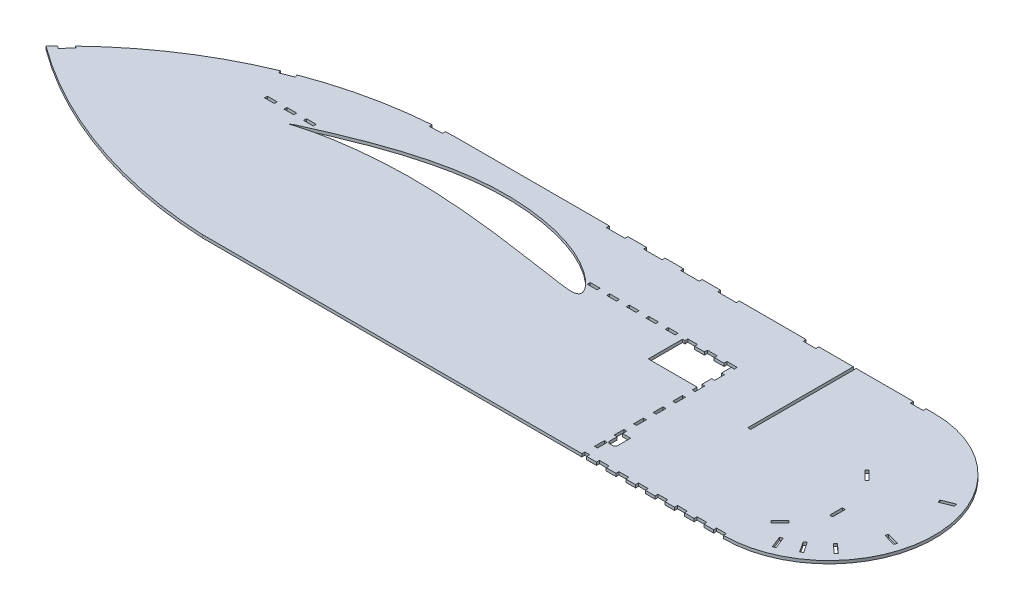
from build123d import *

# Parameters (mm, degrees)
BOSS_EXTRUDE1_DEPTH = 3
SKETCH2_W           = 3
SKETCH2_H           = 13
SKETCH2_W_2         = 13
SKETCH2_H_2         = 3
SKETCH2_W_3         = 19
SKETCH2_W_4         = 10
SKETCH2_H_3         = 10
SKETCH2_W_5         = 4.93
SKETCH2_H_4         = 108
CUT_EXTRUDE1_DEPTH  = 934.342916617


with BuildPart() as part:
    # Sketch1 → Boss-Extrude1 (new body)
    with BuildSketch(Plane(origin=(0, 0, 0), x_dir=(1, 0, 0), z_dir=(0, 1, 0))):
        with BuildLine():
            Line((266.408252791, 0), (800, 0))
            ThreePointArc((800, 0), (908, 108), (800, 216))
            Line((800, 216), (316.294556964, 216))
            ThreePointArc((316.294556964, 216), (154.432198565, 182.326352039), (19.429068043, 86.893169221))
            ThreePointArc((19.429068043, 86.893169221), (136.475600537, 25.133273094), (266.408252791, 0))
        make_face()
    extrude(amount=BOSS_EXTRUDE1_DEPTH)

    # Sketch2 → Cut-Extrude1 (cut, through all)
    with BuildSketch(Plane.XZ):
        Polygon((647.57, -153), (637.57, -153), (637.57, -156), (627.57, -156), (627.57, -153), (617.57, -153), (617.57, -156), (607.57, -156), (607.57, -153), (605.07, -153), (605.07, -118), (655.07, -118), (655.07, -113), (658.07, -113), (658.07, -123), (655.07, -123), (655.07, -133), (658.07, -133), (658.07, -143), (655.07, -143), (655.07, -153), (658.07, -153), (658.07, -156), (647.57, -156), align=None)
        Polygon((823.689305433, -121.232773417), (814.496917278, -130.425161573), (816.618237622, -132.546481916), (825.810625777, -123.354093761), align=None)
        Polygon((833.160643349, -28.105884629), (837.93522035, -16.014424235), (835.144883336, -14.912598773), (830.370306335, -27.004059168), align=None)
        with Locations((837.95655194, -78.816857664)):
            Rectangle(SKETCH2_W, SKETCH2_H)
        with BuildLine():
            Line((658.07, -25.473381029), (658.07, -33))
            Line((658.07, -33), (655.07, -33))
            Line((655.07, -33), (655.07, -43))
            Line((655.07, -43), (658.07, -43))
            Line((658.07, -43), (658.07, -38.673381029))
            Line((658.07, -38.673381029), (666.27, -38.673381029))
            Line((666.27, -38.673381029), (666.27, -25.473381029))
            ThreePointArc((666.27, -25.473381029), (665.537766953, -23.705614076), (663.77, -22.973381029))
            Line((663.77, -22.973381029), (660.57, -22.973381029))
            ThreePointArc((660.57, -22.973381029), (658.802233047, -23.705614076), (658.07, -25.473381029))
        make_face()
        with BuildLine():
            Line((212.57, -142.261782597), (212.57, -142.294782597))
            add(Edge.make_bspline(
                [(212.57, -142.294782597), (212.815137814, -142.460102486), (213.721483955, -143.071338431), (215.664179604, -144.220627165), (218.723437449, -145.777902142), (222.783765044, -147.580430449), (227.75908382, -149.780753256), (233.673151887, -152.372942719), (243.334631626, -156.473964415), (254.071597155, -160.928560196), (265.811315632, -165.551386352), (275.559769605, -169.192616013), (285.820264156, -172.789650289), (300.213165162, -177.442893994), (315.047470761, -181.61442891), (330.216772764, -185.078244178), (341.716798025, -187.262793988), (353.238408154, -188.970546018), (364.74982071, -190.189827969), (376.222154657, -190.889317525), (387.611451467, -191.086885836), (398.853751386, -190.764655348), (413.421420996, -189.696341642), (427.580802498, -187.700042396), (441.195366572, -184.827458978), (450.821943115, -182.319735681), (459.948918056, -179.469695278), (468.511745548, -176.287644359), (476.453624938, -172.824739179), (483.715148146, -169.128859345), (490.24814377, -165.284833696), (496.019667562, -161.40694583), (500.998027396, -157.585747413), (505.147593549, -153.884087589), (508.447339472, -150.382728864), (510.852240131, -147.180842115), (512.23052565, -144.518995071), (512.672376723, -142.438033672), (512.365957104, -140.693980261), (510.836297954, -139.267947677), (508.300825673, -138.604557497), (504.990749494, -138.396901122), (500.845143819, -138.632879923), (495.886387834, -139.207005807), (490.127383335, -140.033765729), (483.600688534, -141.01415409), (476.345974836, -142.081971784), (468.41886468, -143.270863791), (459.86962452, -144.552957933), (447.40415706, -146.414008038), (434.302787697, -148.29198326), (413.230560269, -151.080307043), (394.916461571, -153.170522792), (372.413070638, -155.185169178), (353.278576878, -156.497400442), (334.10390548, -157.12050793), (318.83753012, -157.119300437), (307.569298967, -156.863067348), (296.54483902, -156.342386113), (285.853643217, -155.59861473), (275.586288909, -154.654588864), (265.829573747, -153.556930461), (256.673464041, -152.312824912), (248.205041684, -150.95854436), (240.510067524, -149.523302558), (233.666056009, -148.064077742), (227.735558734, -146.629571507), (222.771530443, -145.20558608), (218.774640723, -143.912633605), (215.724793866, -142.995242016), (213.753356987, -142.496728121), (212.816237246, -142.310670921), (212.57, -142.261782597)],
                knots=[0, 0, 0, 0, 0.001413477, 0.005226038, 0.010781091, 0.017815608, 0.026460951, 0.036790889, 0.048685593, 0.076639155, 0.092362872, 0.109003461, 0.126386903, 0.144339126, 0.181312719, 0.200023431, 0.218712626, 0.237261299, 0.255692478, 0.274037197, 0.292192583, 0.310132767, 0.327788163, 0.362001934, 0.378421226, 0.394286639, 0.40954344, 0.424114253, 0.43793778, 0.450941833, 0.463044023, 0.474154417, 0.484164575, 0.493023962, 0.500713088, 0.507125739, 0.512129705, 0.514904185, 0.517171427, 0.520261618, 0.5242453, 0.529497961, 0.536092185, 0.54406114, 0.553363127, 0.563904543, 0.575614949, 0.588420092, 0.60222661, 0.616944448, 0.648675826, 0.665501113, 0.718564132, 0.736789145, 0.773513212, 0.810244924, 0.828488569, 0.846493195, 0.864125178, 0.88124851, 0.897725282, 0.913415058, 0.928184346, 0.941897285, 0.954411455, 0.965602702, 0.975349728, 0.983575522, 0.990284579, 0.99543259, 0.998799869, 1, 1, 1, 1], degree=3))
        make_face()
        Polygon((879.488683308, -142.121066281), (891.521725575, -147.041014838), (892.657098319, -144.26415893), (880.624056052, -139.344210373), align=None)
        Polygon((883.5475205, -85.58327061), (896.043113277, -81.997163924), (895.215550195, -79.113565591), (882.719957419, -82.699672277), align=None)
        Polygon((865.360730479, -51.33720048), (875.034295558, -42.652608454), (873.030158937, -40.420247282), (863.356593858, -49.104839308), align=None)
        Polygon((849.064781802, -36.758543495), (856.251694152, -25.925801881), (853.751830703, -24.267283646), (846.564918353, -35.10002526), align=None)
        Polygon((822.408918344, -44.734564455), (813.216530188, -35.542176299), (811.095209845, -37.663496643), (820.287598, -46.855884798), align=None)
        with Locations((785, -214.5)):
            Rectangle(SKETCH2_W_2, SKETCH2_H_2)
        with Locations((675.107627624, -214.5)):
            Rectangle(SKETCH2_W_2, SKETCH2_H_2)
        with Locations((590.701810534, -214.5)):
            Rectangle(SKETCH2_W_3, SKETCH2_H_2)
        with Locations((552.701810534, -214.5)):
            Rectangle(SKETCH2_W_3, SKETCH2_H_2)
        with Locations((514.701810534, -214.5)):
            Rectangle(SKETCH2_W_3, SKETCH2_H_2)
        with Locations((476.701810534, -214.5)):
            Rectangle(SKETCH2_W_3, SKETCH2_H_2)
        Polygon((286.653605669, -215.067910052), (299.639993398, -215.662665262), (299.777244601, -212.665806556), (286.790856872, -212.071051345), align=None)
        Polygon((161.18014545, -185.235777135), (173.264783001, -190.027596754), (174.370587528, -187.238834242), (162.285949977, -182.447014623), align=None)
        Polygon((25.225136805, -93.110530953), (34.089712558, -102.619437132), (36.284075522, -100.573765804), (27.419499769, -91.064859625), align=None)
        with Locations((532.57, -154.5)):
            Rectangle(SKETCH2_W_4, SKETCH2_H_2)
        with Locations((552.57, -154.5)):
            Rectangle(SKETCH2_W_4, SKETCH2_H_2)
        with Locations((572.57, -154.5)):
            Rectangle(SKETCH2_W_4, SKETCH2_H_2)
        with Locations((592.57, -154.5)):
            Rectangle(SKETCH2_W_4, SKETCH2_H_2)
        with Locations((656.57, -98)):
            Rectangle(SKETCH2_W, SKETCH2_H_3)
        with Locations((656.57, -78)):
            Rectangle(SKETCH2_W, SKETCH2_H_3)
        with Locations((656.57, -58)):
            Rectangle(SKETCH2_W, SKETCH2_H_3)
        with Locations((656.57, -18)):
            Rectangle(SKETCH2_W, SKETCH2_H_3)
        with Locations((657.535, -1.5)):
            Rectangle(SKETCH2_W_5, SKETCH2_H_2)
        with Locations((675, -1.5)):
            Rectangle(SKETCH2_W_4, SKETCH2_H_2)
        with Locations((695, -1.5)):
            Rectangle(SKETCH2_W_4, SKETCH2_H_2)
        with Locations((715, -1.5)):
            Rectangle(SKETCH2_W_4, SKETCH2_H_2)
        with Locations((735, -1.5)):
            Rectangle(SKETCH2_W_4, SKETCH2_H_2)
        with Locations((755, -1.5)):
            Rectangle(SKETCH2_W_4, SKETCH2_H_2)
        with Locations((775, -1.5)):
            Rectangle(SKETCH2_W_4, SKETCH2_H_2)
        with Locations((795, -1.5)):
            Rectangle(SKETCH2_W_4, SKETCH2_H_2)
        with Locations((182.07, -154.5)):
            Rectangle(SKETCH2_W_4, SKETCH2_H_2)
        with Locations((202.07, -154.5)):
            Rectangle(SKETCH2_W_4, SKETCH2_H_2)
        with Locations((222.07, -154.5)):
            Rectangle(SKETCH2_W_4, SKETCH2_H_2)
        with Locations((512.57, -154.5)):
            Rectangle(SKETCH2_W_4, SKETCH2_H_2)
        with Locations((718.5, -162)):
            Rectangle(SKETCH2_W, SKETCH2_H_4)
    extrude(amount=-CUT_EXTRUDE1_DEPTH, mode=Mode.SUBTRACT)


solid = part.part
